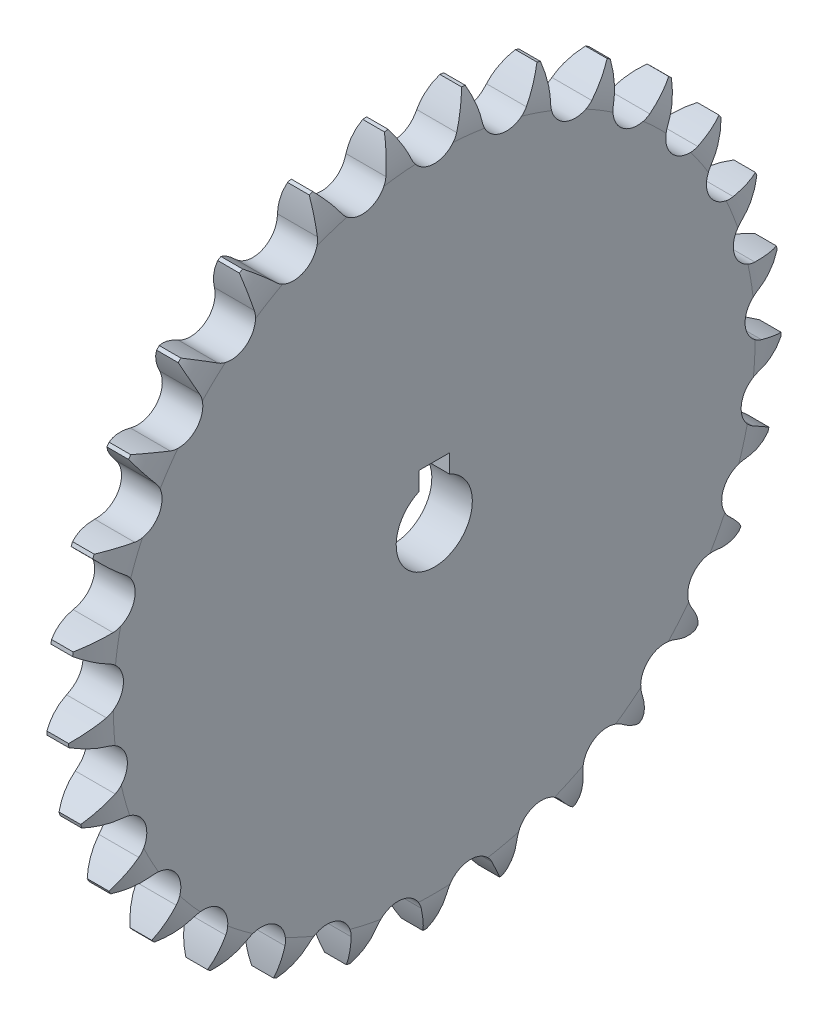
from build123d import *

# Parameters (mm, degrees)
TOOTHCUT_DEPTH      = 67.436416291
TEETHCUTS_COUNT     = 29
TEETHCUTS_ANGLE     = 347.586206897
BORSKE_R            = 10
BORE_DEPTH          = 50.0005
SKETCH1_R           = 30
SKETCH1_R_2         = 5
BOSS_EXTRUDE1_DEPTH = 24.6804
SKETCH2_R           = 10
SKETCH2_R_2         = 5
BOSS_EXTRUDE2_DEPTH = 5.3196
SKETCH3_W           = 4
SKETCH3_H           = 4
CUT_EXTRUDE1_DEPTH  = 73.665372308
SKETCH5_OUTSIDE_W   = 122.652
SKETCH5_OUTSIDE_H   = 122.515
SKETCH5_OUTSIDE_R   = 9
CUT_EXTRUDE3_DEPTH  = 24.6804
CUT_EXTRUDE4_START  = -24.6804
SKETCH6_R           = 12.521476026
CUT_EXTRUDE4_DEPTH  = 24.6804


with BuildPart() as part:
    # BasProSke → Base-Revolve (revolve)
    with BuildSketch(Plane(origin=(0, 0, 0), x_dir=(1, 0, 0), z_dir=(0, 1, 0)), mode=Mode.PRIVATE) as base_revolve_sk:
        with BuildLine():
            Line((0, 0), (0, 42.13092815))
            ThreePointArc((0, 42.13092815), (0.314698702, 44.559091036), (1.238, 46.826804639))
            Line((1.238, 46.826804639), (4.0816, 46.826804639))
            ThreePointArc((4.0816, 46.826804639), (5.004901298, 44.559091036), (5.3196, 42.13092815))
            Line((5.3196, 42.13092815), (5.3196, 0))
            Line((5.3196, 0), (0, 0))
        make_face()
    revolve(base_revolve_sk.sketch.rotate(Axis((-10, 0, 0), (1, 0, 0)), 180), axis=Axis((-10, 0, 0), (1, 0, 0)))

    # TooCutSke → ToothCut (cut, through all)
    with BuildSketch(Plane(origin=(0, 0, 0), x_dir=(0, 0, -1), z_dir=(1, 0, 0))):
        with BuildLine():
            ThreePointArc((2.982554331, 42.90245883), (3.946377791, 45.028760973), (5.115378775, 47.049541308))
            ThreePointArc((5.115378775, 47.049541308), (0, 47.326804639), (-5.115378775, 47.049541308))
            ThreePointArc((-5.115378775, 47.049541308), (-3.946377791, 45.028760973), (-2.982554331, 42.90245883))
            ThreePointArc((-2.982554331, 42.90245883), (0, 40.873679639), (2.982554331, 42.90245883))
        make_face()
    toothcut = extrude(amount=TOOTHCUT_DEPTH, mode=Mode.SUBTRACT)

    # TeethCuts: ToothCut ×29 about axis
    teethcuts_axis = Axis((-10, 0, 0), (1, 0, 0))
    for i in range(1, TEETHCUTS_COUNT):
        add(toothcut.rotate(teethcuts_axis, i * TEETHCUTS_ANGLE / (TEETHCUTS_COUNT - 1)), mode=Mode.SUBTRACT)

    # BorSke → Bore (cut, symmetric)
    with BuildSketch(Plane(origin=(0, 0, 0), x_dir=(0, 0, -1), z_dir=(1, 0, 0))):
        with Locations(Location((0, 0, 0), (0, 0, 180))):
            Circle(BORSKE_R)
    extrude(amount=BORE_DEPTH, both=True, mode=Mode.SUBTRACT)

    # Sketch1 → Boss-Extrude1 (add)
    with BuildSketch(Plane(origin=(5.3196, 0, 0), x_dir=(0, 0, -1), z_dir=(1, 0, 0))):
        with Locations(Location((0, 0, 0), (0, 0, 180))):
            Circle(SKETCH1_R)
        Circle(SKETCH1_R_2, mode=Mode.SUBTRACT)
    extrude(amount=BOSS_EXTRUDE1_DEPTH)

    # Sketch2 → Boss-Extrude2 (add)
    with BuildSketch(Plane.ZY.offset(-5.3196)):
        Circle(SKETCH2_R)
        with Locations(Location((0, 0, 0), (0, 0, 180))):
            Circle(SKETCH2_R_2, mode=Mode.SUBTRACT)
    extrude(amount=BOSS_EXTRUDE2_DEPTH)

    # Sketch3 → Cut-Extrude1 (cut, through all)
    with BuildSketch(Plane(origin=(30, 0, 0), x_dir=(0, 0, -1), z_dir=(1, 0, 0))):
        with Locations((0, 5)):
            Rectangle(SKETCH3_W, SKETCH3_H)
    extrude(amount=-CUT_EXTRUDE1_DEPTH, mode=Mode.SUBTRACT)

    # Sketch5 outside → Cut-Extrude3 (cut)
    with BuildSketch(Plane(origin=(30, 0, 0), x_dir=(0, 0, -1), z_dir=(1, 0, 0))):
        with Locations((0, -0.1245)):
            Rectangle(SKETCH5_OUTSIDE_W, SKETCH5_OUTSIDE_H)
        Circle(SKETCH5_OUTSIDE_R, mode=Mode.SUBTRACT)
    extrude(amount=-CUT_EXTRUDE3_DEPTH, mode=Mode.SUBTRACT)

    # Sketch6 → Cut-Extrude4 (cut)
    with BuildSketch(Plane(origin=(30, 0, 0), x_dir=(0, 0, -1), z_dir=(1, 0, 0)).offset(CUT_EXTRUDE4_START)):
        Circle(SKETCH6_R)
    extrude(amount=CUT_EXTRUDE4_DEPTH, mode=Mode.SUBTRACT)


solid = part.part
